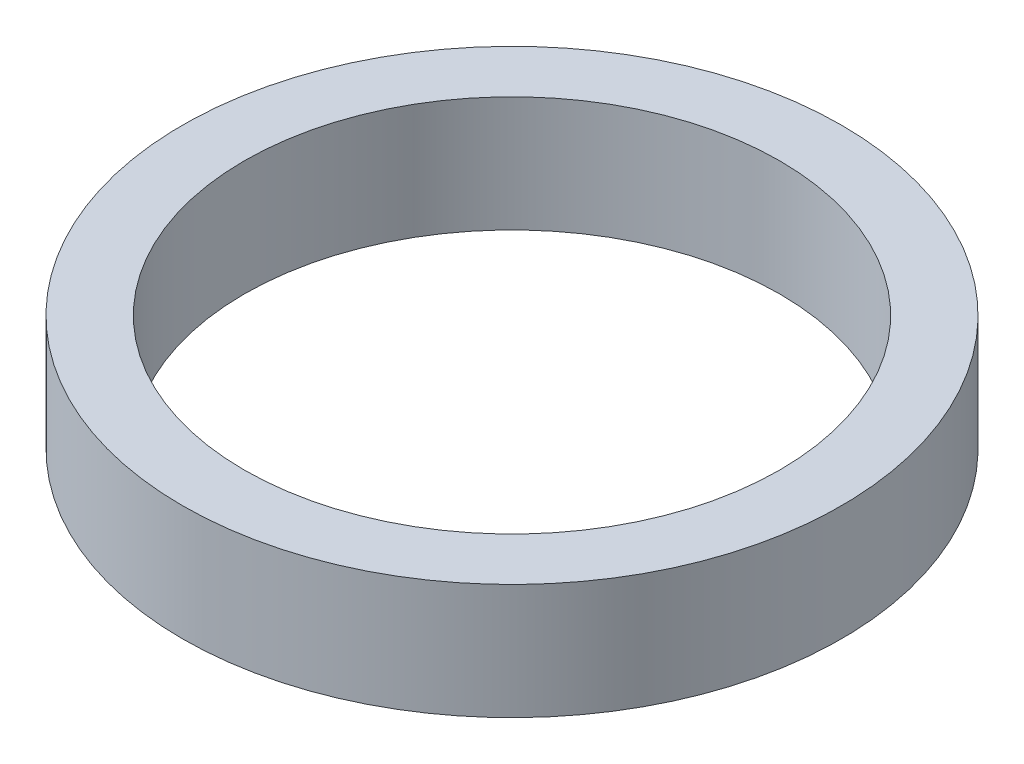
from build123d import *

# Parameters (mm, degrees)
SKETCH1_R           = 40
BOSS_EXTRUDE1_DEPTH = 14
SKETCH2_R           = 32.5
CUT_EXTRUDE1_DEPTH  = 59.275209137


with BuildPart() as part:
    # Sketch1 → Boss-Extrude1 (new body)
    with BuildSketch(Plane(origin=(0, 0, 0), x_dir=(1, 0, 0), z_dir=(0, 1, 0))):
        Circle(SKETCH1_R)
    extrude(amount=BOSS_EXTRUDE1_DEPTH)

    # Sketch2 → Cut-Extrude1 (cut, through all)
    with BuildSketch(Plane(origin=(0, 0, 0), x_dir=(1, 0, 0), z_dir=(0, 1, 0))):
        Circle(SKETCH2_R)
    extrude(amount=CUT_EXTRUDE1_DEPTH, mode=Mode.SUBTRACT)


solid = part.part
